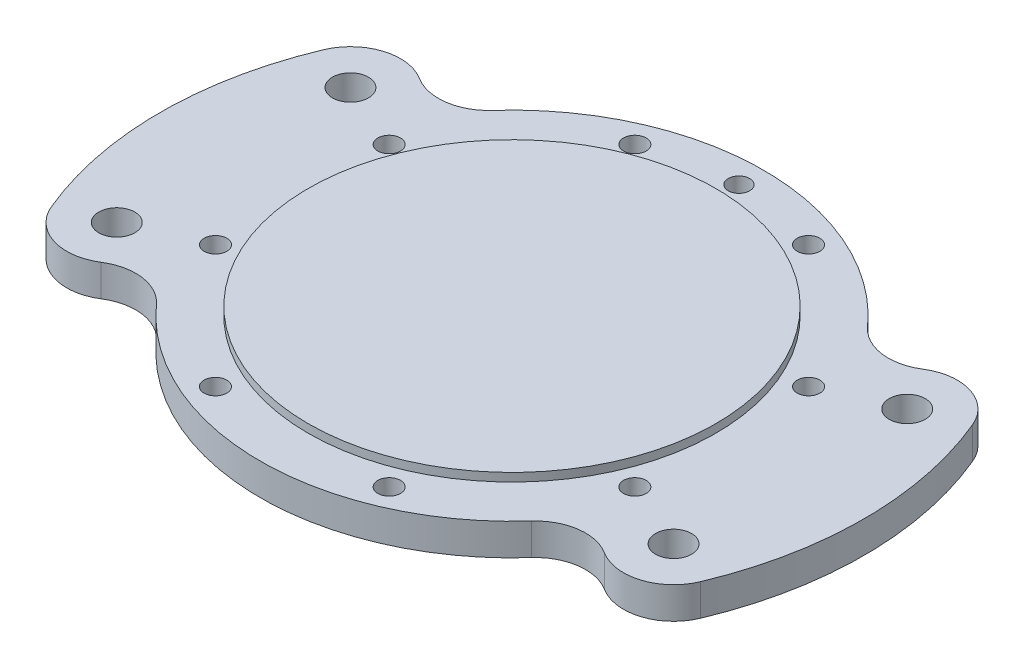
from build123d import *

# Parameters (mm, degrees)
SKETCH1_R                                       = 1
SKETCH1_R_2                                     = 2.7
BOSS_EXTRUDE1_DEPTH                             = 6
FILLET1_R                                       = 7.5
SKETCH2_R                                       = 1.6
CUT_EXTRUDE1_DEPTH                              = 66.108380797
SKETCH3_OUTSIDE_W                               = 133.41
SKETCH3_OUTSIDE_H                               = 103.41
SKETCH3_OUTSIDE_R                               = 30.525
CUT_EXTRUDE3_DEPTH                              = 1.25
CSK_FOR_M3_FLAT_HEAD_MACHINE_SCREW1_D           = 3.4
CSK_FOR_M3_FLAT_HEAD_MACHINE_SCREW1_CSINK_D     = 6.3
CSK_FOR_M3_FLAT_HEAD_MACHINE_SCREW1_CSINK_ANGLE = 90


with BuildPart() as part:
    # Sketch1 → Boss-Extrude1 (new body)
    with BuildSketch(Plane(origin=(0, 0, 0), x_dir=(1, 0, 0), z_dir=(0, 1, 0))):
        with BuildLine():
            Line((31.883633055, 20.164562188), (44.561021943, 28.182280752))
            ThreePointArc((44.561021943, 28.182280752), (52.725, 0), (44.561021943, -28.182280752))
            Line((44.561021943, -28.182280752), (31.883633055, -20.164562188))
            ThreePointArc((31.883633055, -20.164562188), (0, -37.725), (-31.883633055, -20.164562188))
            Line((-31.883633055, -20.164562188), (-44.561021943, -28.182280752))
            ThreePointArc((-44.561021943, -28.182280752), (-52.725, 0), (-44.561021943, 28.182280752))
            Line((-44.561021943, 28.182280752), (-31.883633055, 20.164562188))
            ThreePointArc((-31.883633055, 20.164562188), (0, 37.725), (31.883633055, 20.164562188))
        make_face()
        with Locations(Location((-13.0112367, 31.411904105, 0), (0, 0, 270))):
            Circle(SKETCH1_R, mode=Mode.SUBTRACT)
        with Locations(Location((13.0112367, 31.411904105, 0), (0, 0, 270))):
            Circle(SKETCH1_R, mode=Mode.SUBTRACT)
        with Locations(Location((31.411904105, 13.0112367, 0), (0, 0, 270))):
            Circle(SKETCH1_R, mode=Mode.SUBTRACT)
        with Locations(Location((31.411904105, -13.0112367, 0), (0, 0, 270))):
            Circle(SKETCH1_R, mode=Mode.SUBTRACT)
        with Locations(Location((13.0112367, -31.411904105, 0), (0, 0, 270))):
            Circle(SKETCH1_R, mode=Mode.SUBTRACT)
        with Locations(Location((-13.0112367, -31.411904105, 0), (0, 0, 270))):
            Circle(SKETCH1_R, mode=Mode.SUBTRACT)
        with Locations(Location((-31.411904105, -13.0112367, 0), (0, 0, 270))):
            Circle(SKETCH1_R, mode=Mode.SUBTRACT)
        with Locations(Location((-31.411904105, 13.0112367, 0), (0, 0, 270))):
            Circle(SKETCH1_R, mode=Mode.SUBTRACT)
        with Locations(Location((41.701925915, 17.5, 0), (0, 0, 270))):
            Circle(SKETCH1_R_2, mode=Mode.SUBTRACT)
        with Locations(Location((41.701925915, -17.5, 0), (0, 0, 270))):
            Circle(SKETCH1_R_2, mode=Mode.SUBTRACT)
        with Locations(Location((-41.701925915, 17.5, 0), (0, 0, 90))):
            Circle(SKETCH1_R_2, mode=Mode.SUBTRACT)
        with Locations(Location((-41.701925915, -17.5, 0), (0, 0, 90))):
            Circle(SKETCH1_R_2, mode=Mode.SUBTRACT)
    extrude(amount=BOSS_EXTRUDE1_DEPTH)

    # Fillet1
    fillet1_edges = [part.edges().sort_by_distance(p)[0] for p in [
        (44.561021943, 3, 28.182280752),
        (31.883633055, 3, 20.164562188),
        (-44.561021943, 3, 28.182280752),
        (-31.883633055, 3, 20.164562188),
        (44.561021943, 3, -28.182280752),
        (31.883633055, 3, -20.164562188),
        (-44.561021943, 3, -28.182280752),
        (-31.883633055, 3, -20.164562188),
    ]]
    fillet(fillet1_edges, radius=FILLET1_R - 0.0001)  # a hair under: the kernel refuses the full size

    # Sketch2 → Cut-Extrude1 (cut, through all)
    with BuildSketch(Plane(origin=(0, 6, 0), x_dir=(1, 0, 0), z_dir=(0, 1, 0))):
        with Locations(Location((0, 34, 0), (0, 0, 270))):
            Circle(SKETCH2_R)
    extrude(amount=-CUT_EXTRUDE1_DEPTH, mode=Mode.SUBTRACT)

    # Sketch3 outside → Cut-Extrude3 (cut)
    with BuildSketch(Plane(origin=(0, 6, 0), x_dir=(1, 0, 0), z_dir=(0, 1, 0))):
        Rectangle(SKETCH3_OUTSIDE_W, SKETCH3_OUTSIDE_H)
        with Locations(Location((0, 0, 0), (0, 0, 270))):
            Circle(SKETCH3_OUTSIDE_R, mode=Mode.SUBTRACT)
    extrude(amount=-CUT_EXTRUDE3_DEPTH, mode=Mode.SUBTRACT)

    # CSK for M3 Flat Head Machine Screw1 (through all)
    with Locations(Plane(origin=(0, 0, 0), x_dir=(-1, 0, 0), z_dir=(0, -1, 0))):
        with Locations((13.0112367, -31.411904105), (-13.0112367, -31.411904105), (-31.411904105, -13.0112367), (-31.411904105, 13.0112367), (-13.0112367, 31.411904105), (13.0112367, 31.411904105), (31.411904105, 13.0112367), (31.411904105, -13.0112367)):
            CounterSinkHole(CSK_FOR_M3_FLAT_HEAD_MACHINE_SCREW1_D / 2, CSK_FOR_M3_FLAT_HEAD_MACHINE_SCREW1_CSINK_D / 2, counter_sink_angle=CSK_FOR_M3_FLAT_HEAD_MACHINE_SCREW1_CSINK_ANGLE)


solid = part.part
